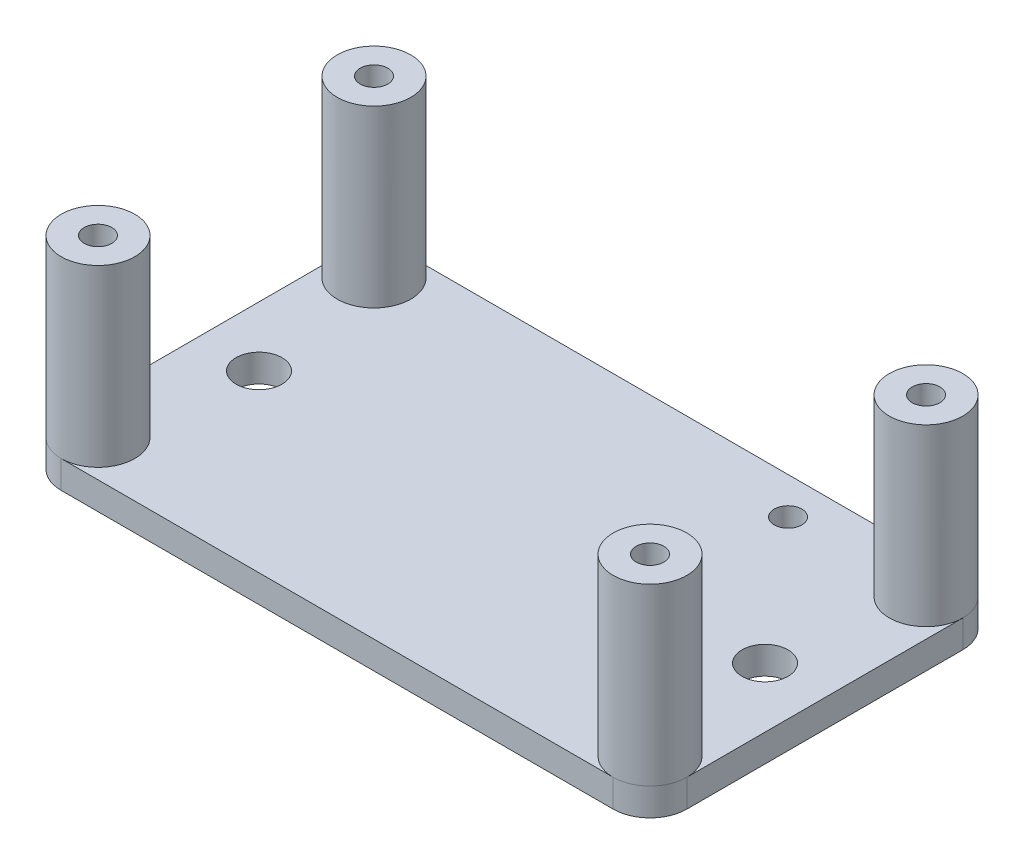
from build123d import *

# Parameters (mm, degrees)
SKETCH_1_W      = 68
SKETCH_1_H      = 38
SKETCH_1_R      = 1.5
SKETCH_1_R_2    = 2.5
EXTRUDE_1_DEPTH = 3
SKETCH_2_R      = 4
SKETCH_2_R_2    = 1.5
EXTRUDE_2_DEPTH = 19
FILLET_1_R      = 4


with BuildPart() as part:
    # 草图1 → 凸台-拉伸1 (new body)
    with BuildSketch(Plane(origin=(0, 0, 0), x_dir=(1, 0, 0), z_dir=(0, 1, 0))):
        with Locations((10, -0.865384615)):
            Rectangle(SKETCH_1_W, SKETCH_1_H)
        with Locations(Location((-20, -15.865384615, 0), (0, 0, 270))):
            Circle(SKETCH_1_R, mode=Mode.SUBTRACT)
        with Locations(Location((-20, 14.134615385, 0), (0, 0, 270))):
            Circle(SKETCH_1_R, mode=Mode.SUBTRACT)
        with Locations(Location((40, 14.134615385, 0), (0, 0, 270))):
            Circle(SKETCH_1_R, mode=Mode.SUBTRACT)
        with Locations(Location((40, -15.865384615, 0), (0, 0, 270))):
            Circle(SKETCH_1_R, mode=Mode.SUBTRACT)
        with Locations(Location((-17.5, -0.865384615, 0), (0, 0, 270))):
            Circle(SKETCH_1_R_2, mode=Mode.SUBTRACT)
        with Locations(Location((37.5, -0.865384615, 0), (0, 0, 90))):
            Circle(SKETCH_1_R_2, mode=Mode.SUBTRACT)
        with Locations(Location((25, 14.134615385, 0), (0, 0, 270))):
            Circle(SKETCH_1_R, mode=Mode.SUBTRACT)
    extrude(amount=EXTRUDE_1_DEPTH)

    # 草图2 → 凸台-拉伸2 (add)
    # profile 1 of 4: a face of its own
    with BuildSketch(Plane(origin=(0, 3, 0), x_dir=(1, 0, 0), z_dir=(0, 1, 0))):
        with Locations(Location((-20, -15.865384615, 0), (0, 0, 270))):
            Circle(SKETCH_2_R)
        with Locations(Location((-20, -15.865384615, 0), (0, 0, 270))):
            Circle(SKETCH_2_R_2, mode=Mode.SUBTRACT)
    # profile 2 of 4: a face of its own
    with BuildSketch(Plane(origin=(0, 3, 0), x_dir=(1, 0, 0), z_dir=(0, 1, 0))):
        with Locations(Location((40, -15.865384615, 0), (0, 0, 270))):
            Circle(SKETCH_2_R)
        with Locations(Location((40, -15.865384615, 0), (0, 0, 270))):
            Circle(SKETCH_2_R_2, mode=Mode.SUBTRACT)
    # profile 3 of 4: a face of its own
    with BuildSketch(Plane(origin=(0, 3, 0), x_dir=(1, 0, 0), z_dir=(0, 1, 0))):
        with Locations(Location((-20, 14.134615385, 0), (0, 0, 90))):
            Circle(SKETCH_2_R)
        with Locations(Location((-20, 14.134615385, 0), (0, 0, 270))):
            Circle(SKETCH_2_R_2, mode=Mode.SUBTRACT)
    # profile 4 of 4: a face of its own
    with BuildSketch(Plane(origin=(0, 3, 0), x_dir=(1, 0, 0), z_dir=(0, 1, 0))):
        with Locations(Location((40, 14.134615385, 0), (0, 0, 90))):
            Circle(SKETCH_2_R)
        with Locations(Location((40, 14.134615385, 0), (0, 0, 270))):
            Circle(SKETCH_2_R_2, mode=Mode.SUBTRACT)
    extrude(amount=EXTRUDE_2_DEPTH)

    # 圆角1
    fillet_1_edges = [part.edges().sort_by_distance(p)[0] for p in [
        (44, 1.5, 19.865384615),
        (44, 1.5, -18.134615385),
        (-24, 1.5, -18.134615385),
        (-24, 1.5, 19.865384615),
    ]]
    fillet(fillet_1_edges, radius=FILLET_1_R - 0.0001)  # a hair under: the kernel refuses the full size


solid = part.part
